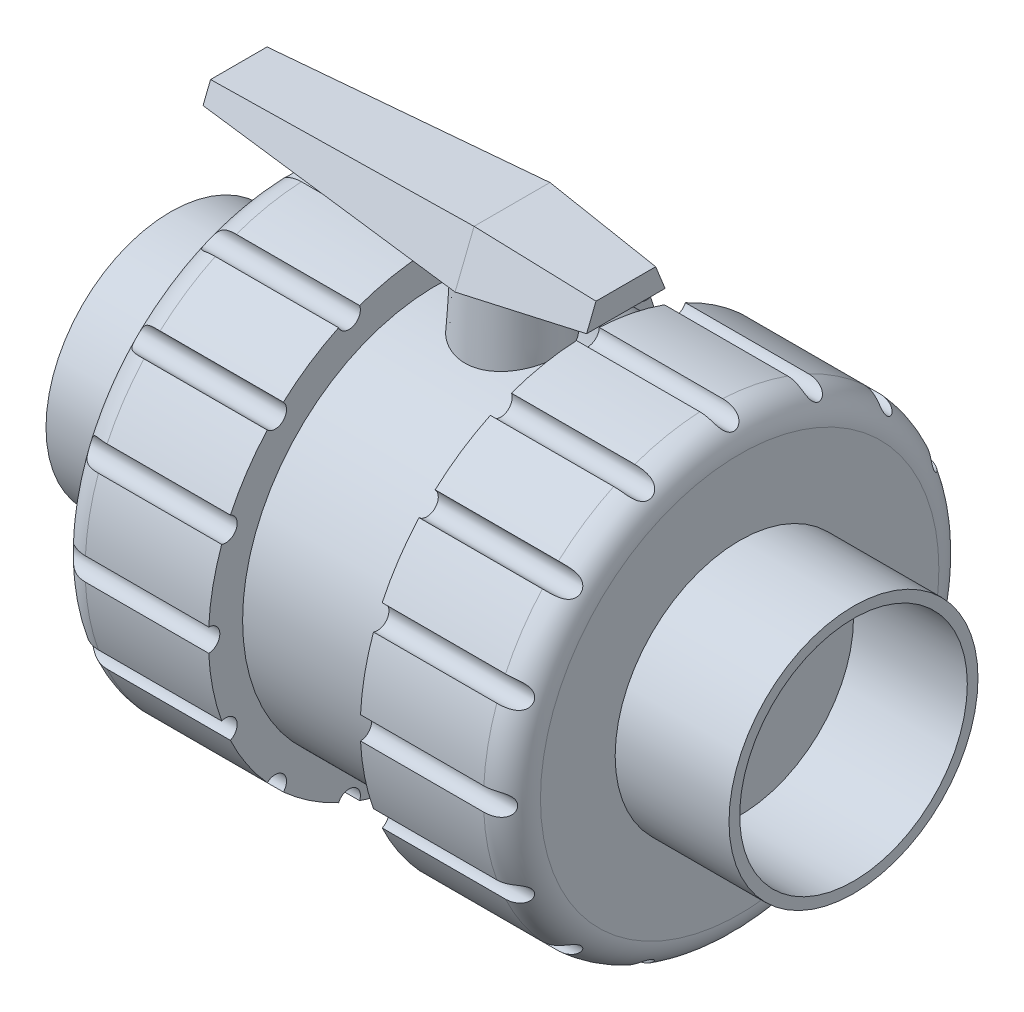
from build123d import *

# Parameters (mm, degrees)
SKETCH_1_R                = 17.5
SKETCH_1_R_2              = 16
EXTRUDE_1_DEPTH           = 48
EXTRUDE_START             = -16
SKETCH_2_R                = 32
EXTRUDE_1_2_DEPTH         = 32
CUT_EXTRUDE_START         = -21.333333333
SKETCH_3_OUTSIDE_W        = 86.49
SKETCH_3_OUTSIDE_H        = 86.49
SKETCH_3_OUTSIDE_R        = 27.2
CUT_EXTRUDE_1_DEPTH       = 35.092292509
FILLET_2_R                = 4
CUT_EXTRUDE_2_REACH       = 57.426
SKETCH_4_R                = 1.6
PATTERN_CIRCULAR_1_COUNT  = 16
SKETCH_5_R                = 8
EXTRUDE_2_DEPTH           = 38.4
EXTRUDE_2_TAPER           = 3
EXTRUDE_3_DEPTH           = 16
EXTRUDE_3_TAPER           = 6
EXTRUDE_3_OTHER_WAY_DEPTH = 38.4
EXTRUDE_3_OTHER_WAY_TAPER = 3


# Read off the part's stored shape, not the designer's step: Зеркальное отражение2
with BuildPart() as part:
    # Эскиз1 → Extrude 1 (new body)
    with BuildSketch(Plane(origin=(0, 0, 0), x_dir=(0, 0, -1), z_dir=(1, 0, 0))):
        Circle(SKETCH_1_R)
        Circle(SKETCH_1_R_2, mode=Mode.SUBTRACT)
    extrude(amount=-EXTRUDE_1_DEPTH)

    # Эскиз2 → Extrude 1 2 (add)
    with BuildSketch(Plane.ZY.offset(48).offset(EXTRUDE_START)):
        Circle(SKETCH_2_R)
    extrude(amount=-EXTRUDE_1_2_DEPTH)

    # Эскиз3 outside → Вырез-Вытянуть1 (cut, through all)
    with BuildSketch(Plane.ZY.offset(32).offset(CUT_EXTRUDE_START)):
        Rectangle(SKETCH_3_OUTSIDE_W, SKETCH_3_OUTSIDE_H)
        Circle(SKETCH_3_OUTSIDE_R, mode=Mode.SUBTRACT)
    extrude(amount=-CUT_EXTRUDE_1_DEPTH, mode=Mode.SUBTRACT)

    # Скругление2
    fillet_2_edges = [part.edges().sort_by_distance(p)[0] for p in [
        (-32, 0, -32),
    ]]
    fillet(fillet_2_edges, radius=FILLET_2_R)

    # Эскиз4 → Вырез-Вытянуть2 (cut, up to next)
    with BuildSketch(Plane.ZY.offset(32), mode=Mode.PRIVATE) as cut_extrude_2_sk1:
        with Locations((0, 32)):
            Circle(SKETCH_4_R)
    cut_extrude_2_tool1 = extrude(cut_extrude_2_sk1.sketch, amount=-CUT_EXTRUDE_2_REACH, mode=Mode.PRIVATE) & part.part
    cut_extrude_2 = cut_extrude_2_tool1.solids().sort_by_distance((-32, 32, 0))[0]
    add(cut_extrude_2, mode=Mode.SUBTRACT)

    # Круговой массив1: Вырез-Вытянуть2 ×16 about axis
    pattern_circular_1_axis = Axis((0, 0, 0), (1, 0, 0))
    for i in range(1, PATTERN_CIRCULAR_1_COUNT):
        add(cut_extrude_2.rotate(pattern_circular_1_axis, i * 360 / PATTERN_CIRCULAR_1_COUNT), mode=Mode.SUBTRACT)

    # Зеркальное отражение2: part across plane


with BuildPart() as part_1:
    add(part.part)
    add(part.part.mirror(Plane(origin=(0, 0, 0), x_dir=(0, 0, 1), z_dir=(1, 0, 0))))

    # Эскиз5 → Бобышка-Вытянуть2 (add)
    with BuildSketch(Plane(origin=(0, 0, 0), x_dir=(1, 0, 0), z_dir=(0, 1, 0))):
        Circle(SKETCH_5_R)
    extrude(amount=EXTRUDE_2_DEPTH, taper=EXTRUDE_2_TAPER)


with BuildPart() as body_2:
    # Эскиз6 → Бобышка-Вытянуть3 (new body)
    with BuildSketch(Plane(origin=(0, 0, 0), x_dir=(0, 0, -1), z_dir=(1, 0, 0))):
        Polygon((-8, 35.733333333), (8, 35.733333333), (5.333333333, 42.4), (-5.333333333, 42.4), align=None)
    extrude(amount=EXTRUDE_3_DEPTH, taper=EXTRUDE_3_TAPER)

    # Эскиз6 → Бобышка-Вытянуть3 other way (add)
    with BuildSketch(Plane(origin=(0, 0, 0), x_dir=(0, 0, -1), z_dir=(1, 0, 0))):
        Polygon((-8, 35.733333333), (8, 35.733333333), (5.333333333, 42.4), (-5.333333333, 42.4), align=None)
    extrude(amount=-EXTRUDE_3_OTHER_WAY_DEPTH, taper=EXTRUDE_3_OTHER_WAY_TAPER)


solid = Compound([part_1.part, body_2.part])
